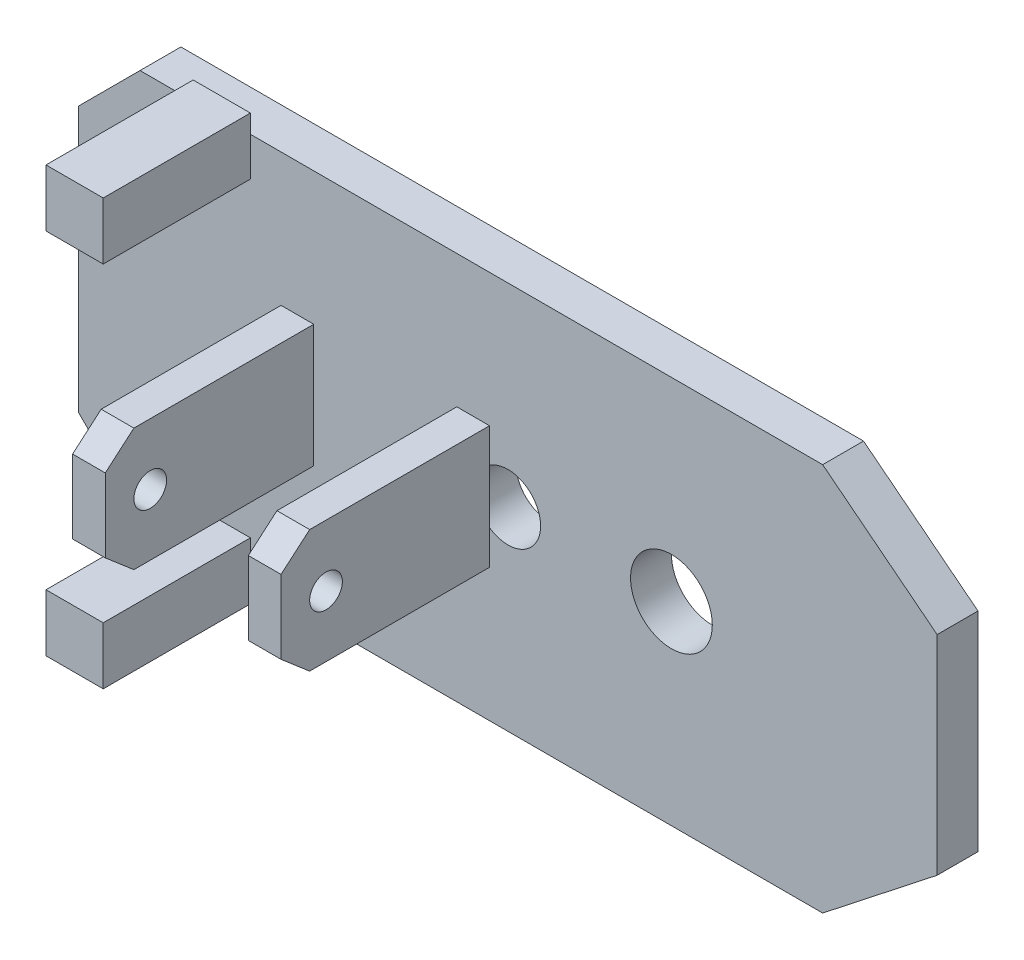
from build123d import *

# Parameters (mm, degrees)
SK_SOLE_PLATE_R    = 10
SK_SOLE_PLATE_R_2  = 8
SOLE_PLATE_DEPTH   = 10
SK_CLEVIS_FRONT_R  = 4
CLEVIS_FRONT_DEPTH = 8
SK_CLEVIS_BACK_R   = 4
CLEVIS_BACK_DEPTH  = 8
SK_POST_LAT_W      = 14
SK_POST_LAT_H      = 14
POST_LAT_DEPTH     = 36
SK_POST_MED_W      = 14
SK_POST_MED_H      = 14
POST_MED_DEPTH     = 36


with BuildPart() as part:
    # SK_Sole_Plate → Sole_Plate (new body)
    with BuildSketch(Plane.XY.offset(-50)):
        Polygon((-60, -47.5), (107, -47.5), (135, -25.5), (135, 25.5), (107, 47.5), (-60, 47.5), (-75, 32.5), (-75, -32.5), align=None)
        with Locations((70, 0)):
            Circle(SK_SOLE_PLATE_R, mode=Mode.SUBTRACT)
        with Locations((30, 0)):
            Circle(SK_SOLE_PLATE_R_2, mode=Mode.SUBTRACT)
    extrude(amount=SOLE_PLATE_DEPTH)

    # SK_Clevis_Front → Clevis_Front (add)
    with BuildSketch(Plane(origin=(17.5, 0, 0), x_dir=(0, 0, -1), z_dir=(1, 0, 0))):
        Polygon((40, -15), (40, 15), (-4, 15), (-11, 9), (-11, -9), (-4, -15), align=None)
        Circle(SK_CLEVIS_FRONT_R, mode=Mode.SUBTRACT)
    extrude(amount=CLEVIS_FRONT_DEPTH)

    # SK_Clevis_Back → Clevis_Back (add)
    with BuildSketch(Plane(origin=(-25.5, 0, 0), x_dir=(0, 0, -1), z_dir=(1, 0, 0))):
        Polygon((40, -15), (40, 15), (-4, 15), (-11, 9), (-11, -9), (-4, -15), align=None)
        Circle(SK_CLEVIS_BACK_R, mode=Mode.SUBTRACT)
    extrude(amount=CLEVIS_BACK_DEPTH)

    # SK_Post_Lat → Post_Lat (add)
    with BuildSketch(Plane.XY.offset(-40)):
        with Locations((-40, 45)):
            Rectangle(SK_POST_LAT_W, SK_POST_LAT_H)
    extrude(amount=POST_LAT_DEPTH)

    # SK_Post_Med → Post_Med (add)
    with BuildSketch(Plane.XY.offset(-40)):
        with Locations((-40, -45)):
            Rectangle(SK_POST_MED_W, SK_POST_MED_H)
    extrude(amount=POST_MED_DEPTH)


solid = part.part
